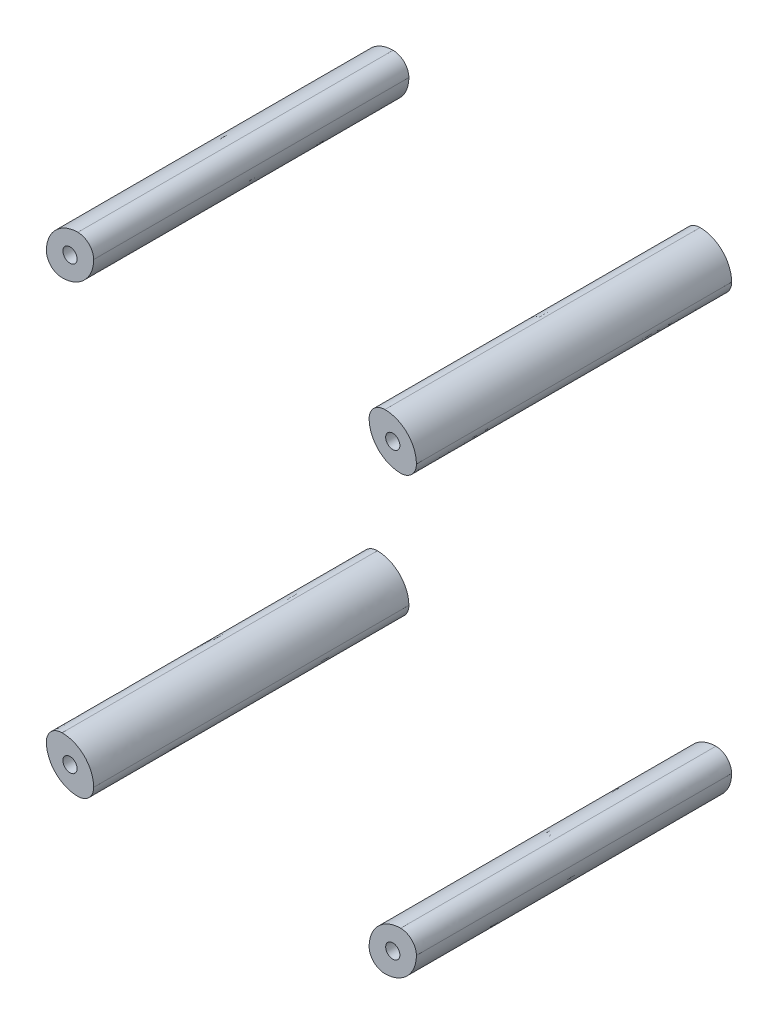
from build123d import *

# Parameters (mm, degrees)
BOSS_EXTRU_1_DEPTH  = 100
D_GAGEMENT_M41_D    = 4.5
SYM_TRIE1_OUTLINE_R = 2.25
SYM_TRIE1_DEPTH     = 100


# Read off the part's stored shape, not the designer's step: Symétrie1
with BuildPart() as part:
    # Esquisse3 → Boss.-Extru.1 (new body)
    with BuildSketch(Plane.XY):
        with BuildLine():
            add(Edge.make_bspline(
                [(-53.696481526, -140), (-54.350979992, -140), (-55.659758626, -140.260049966), (-57.324141098, -141.372340428), (-58.43643156, -143.0367229), (-58.696481526, -144.345501535), (-58.696481526, -145)],
                knots=[0, 0, 0, 0, 0.041666667, 0.083333333, 0.125, 0.166666667, 0.166666667, 0.166666667, 0.166666667], degree=3))
            add(Edge.make_bspline(
                [(-58.696481526, -145), (-58.696481526, -146.30899693), (-58.176232277, -148.926576098), (-55.951861831, -152.255380305), (-52.623057625, -154.479750751), (-50.005478457, -155), (-48.696481526, -155)],
                knots=[0.166666667, 0.166666667, 0.166666667, 0.166666667, 0.25, 0.333333333, 0.416666667, 0.5, 0.5, 0.5, 0.5], degree=3))
            add(Edge.make_bspline(
                [(-48.696481526, -155), (-48.041983061, -155), (-46.733204427, -154.739950034), (-45.068821955, -153.627659572), (-43.956531493, -151.9632771), (-43.696481526, -150.654498465), (-43.696481526, -150)],
                knots=[0.5, 0.5, 0.5, 0.5, 0.541666667, 0.583333333, 0.625, 0.666666667, 0.666666667, 0.666666667, 0.666666667], degree=3))
            add(Edge.make_bspline(
                [(-43.696481526, -150), (-43.696481526, -148.69100307), (-44.216730775, -146.073423902), (-46.441101222, -142.744619695), (-49.769905428, -140.520249249), (-52.387484596, -140), (-53.696481526, -140)],
                knots=[0.666666667, 0.666666667, 0.666666667, 0.666666667, 0.75, 0.833333333, 0.916666667, 1, 1, 1, 1], degree=3))
        make_face()
    extrude(amount=BOSS_EXTRU_1_DEPTH)

    # Dégagement M41 (through all)
    with Locations(Plane.XY.offset(100)):
        with Locations((-51.196481526, -147.5)):
            Hole(D_GAGEMENT_M41_D / 2)


with BuildPart() as body_2:
    # Symétrie1 outline → Symétrie1 (new body)
    # profile 1 of 3: a face of its own
    with BuildSketch(Plane.XY):
        with BuildLine():
            add(Edge.make_bspline(
                [(43.696481526, -5), (43.696481526, -6.30899693), (44.216730775, -8.926576098), (46.441101222, -12.255380305), (49.769905428, -14.479750751), (52.387484596, -15), (53.696481526, -15)],
                knots=[0.666666667, 0.666666667, 0.666666667, 0.666666667, 0.75, 0.833333333, 0.916666667, 1, 1, 1, 1], degree=3))
            add(Edge.make_bspline(
                [(53.696481526, -15), (54.350979992, -15), (55.659758626, -14.739950034), (57.324141098, -13.627659572), (58.43643156, -11.9632771), (58.696481526, -10.654498465), (58.696481526, -10)],
                knots=[0, 0, 0, 0, 0.041666667, 0.083333333, 0.125, 0.166666667, 0.166666667, 0.166666667, 0.166666667], degree=3))
            add(Edge.make_bspline(
                [(58.696481526, -10), (58.696481526, -8.69100307), (58.176232277, -6.073423902), (55.951861831, -2.744619695), (52.623057625, -0.520249249), (50.005478457, 0), (48.696481526, 0)],
                knots=[0.166666667, 0.166666667, 0.166666667, 0.166666667, 0.25, 0.333333333, 0.416666667, 0.5, 0.5, 0.5, 0.5], degree=3))
            add(Edge.make_bspline(
                [(48.696481526, 0), (48.041983061, 0), (46.733204427, -0.260049966), (45.068821955, -1.372340428), (43.956531493, -3.0367229), (43.696481526, -4.345501535), (43.696481526, -5)],
                knots=[0.5, 0.5, 0.5, 0.5, 0.541666667, 0.583333333, 0.625, 0.666666667, 0.666666667, 0.666666667, 0.666666667], degree=3))
        make_face()
        with Locations((51.196481526, -7.5)):
            Circle(SYM_TRIE1_OUTLINE_R, mode=Mode.SUBTRACT)
    # profile 2 of 3: a face of its own
    with BuildSketch(Plane.XY):
        with BuildLine():
            add(Edge.make_bspline(
                [(-53.696481526, -15), (-54.350979992, -15), (-55.659758626, -14.739950034), (-57.324141098, -13.627659572), (-58.43643156, -11.9632771), (-58.696481526, -10.654498465), (-58.696481526, -10)],
                knots=[0, 0, 0, 0, 0.041666667, 0.083333333, 0.125, 0.166666667, 0.166666667, 0.166666667, 0.166666667], degree=3))
            add(Edge.make_bspline(
                [(-43.696481526, -5), (-43.696481526, -6.30899693), (-44.216730775, -8.926576098), (-46.441101222, -12.255380305), (-49.769905428, -14.479750751), (-52.387484596, -15), (-53.696481526, -15)],
                knots=[0.666666667, 0.666666667, 0.666666667, 0.666666667, 0.75, 0.833333333, 0.916666667, 1, 1, 1, 1], degree=3))
            add(Edge.make_bspline(
                [(-48.696481526, 0), (-48.041983061, 0), (-46.733204427, -0.260049966), (-45.068821955, -1.372340428), (-43.956531493, -3.0367229), (-43.696481526, -4.345501535), (-43.696481526, -5)],
                knots=[0.5, 0.5, 0.5, 0.5, 0.541666667, 0.583333333, 0.625, 0.666666667, 0.666666667, 0.666666667, 0.666666667], degree=3))
            add(Edge.make_bspline(
                [(-58.696481526, -10), (-58.696481526, -8.69100307), (-58.176232277, -6.073423902), (-55.951861831, -2.744619695), (-52.623057625, -0.520249249), (-50.005478457, 0), (-48.696481526, 0)],
                knots=[0.166666667, 0.166666667, 0.166666667, 0.166666667, 0.25, 0.333333333, 0.416666667, 0.5, 0.5, 0.5, 0.5], degree=3))
        make_face()
        with Locations((-51.196481526, -7.5)):
            Circle(SYM_TRIE1_OUTLINE_R, mode=Mode.SUBTRACT)
    # profile 3 of 3: a face of its own
    with BuildSketch(Plane.XY):
        with BuildLine():
            add(Edge.make_bspline(
                [(53.696481526, -140), (54.350979992, -140), (55.659758626, -140.260049966), (57.324141098, -141.372340428), (58.43643156, -143.0367229), (58.696481526, -144.345501535), (58.696481526, -145)],
                knots=[0, 0, 0, 0, 0.041666667, 0.083333333, 0.125, 0.166666667, 0.166666667, 0.166666667, 0.166666667], degree=3))
            add(Edge.make_bspline(
                [(43.696481526, -150), (43.696481526, -148.69100307), (44.216730775, -146.073423902), (46.441101222, -142.744619695), (49.769905428, -140.520249249), (52.387484596, -140), (53.696481526, -140)],
                knots=[0.666666667, 0.666666667, 0.666666667, 0.666666667, 0.75, 0.833333333, 0.916666667, 1, 1, 1, 1], degree=3))
            add(Edge.make_bspline(
                [(48.696481526, -155), (48.041983061, -155), (46.733204427, -154.739950034), (45.068821955, -153.627659572), (43.956531493, -151.9632771), (43.696481526, -150.654498465), (43.696481526, -150)],
                knots=[0.5, 0.5, 0.5, 0.5, 0.541666667, 0.583333333, 0.625, 0.666666667, 0.666666667, 0.666666667, 0.666666667], degree=3))
            add(Edge.make_bspline(
                [(58.696481526, -145), (58.696481526, -146.30899693), (58.176232277, -148.926576098), (55.951861831, -152.255380305), (52.623057625, -154.479750751), (50.005478457, -155), (48.696481526, -155)],
                knots=[0.166666667, 0.166666667, 0.166666667, 0.166666667, 0.25, 0.333333333, 0.416666667, 0.5, 0.5, 0.5, 0.5], degree=3))
        make_face()
        with Locations((51.196481526, -147.5)):
            Circle(SYM_TRIE1_OUTLINE_R, mode=Mode.SUBTRACT)
    extrude(amount=SYM_TRIE1_DEPTH)


solid = Compound([part.part, body_2.part])
